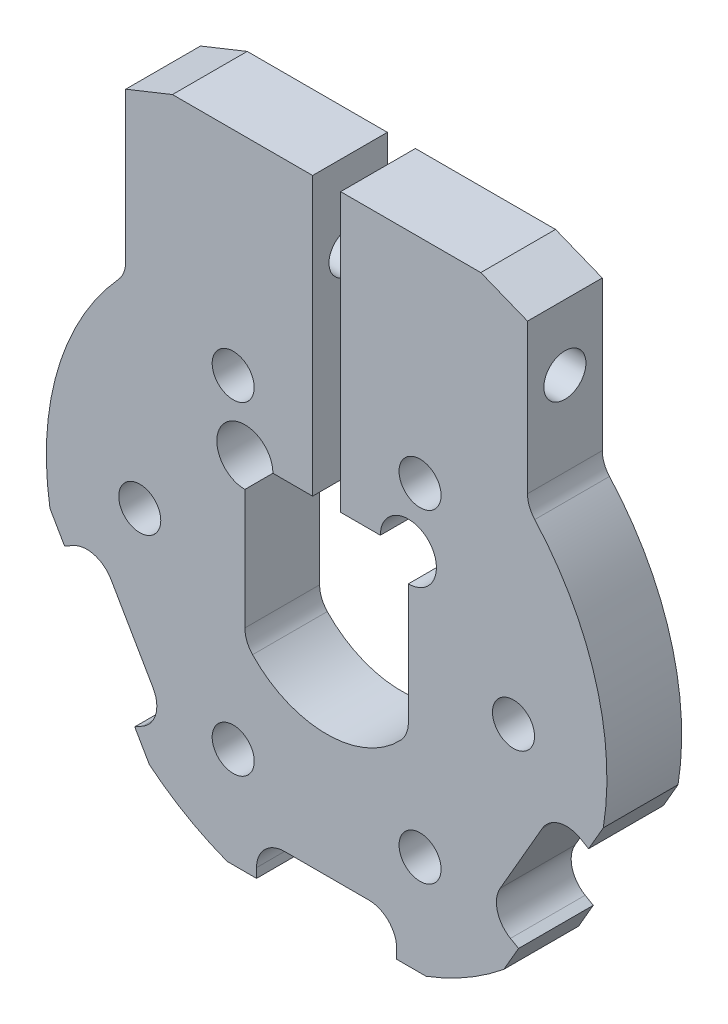
from build123d import *

# Parameters (mm, degrees)
AUFSATZ_LINEAR_AUSTRAGEN1_DEPTH = 8
DURCHGANGSLOCH_F_R_M41_D        = 4.5
DURCHGANGSLOCH_F_R_M42_D        = 4.5


with BuildPart() as part:
    # Skizze1 → Aufsatz-Linear austragen1 (new body)
    with BuildSketch(Plane.XY):
        with BuildLine():
            Line((4.5, -24.047375097), (-4.5, -24.047375097))
            ThreePointArc((-4.5, -24.047375097), (-6.621320344, -24.926054753), (-7.5, -27.047375097))
            Line((-7.5, -27.047375097), (-7.5, -28.047375097))
            Line((-7.5, -28.047375097), (-10.646349149, -28.047375097))
            ThreePointArc((-10.646349149, -28.047375097), (-15, -25.980762114), (-18.966564769, -23.243696368))
            Line((-18.966564769, -23.243696368), (-20.539739343, -20.518878077))
            Line((-20.539739343, -20.518878077), (-19.673713939, -20.018878077))
            ThreePointArc((-19.673713939, -20.018878077), (-18.27593646, -18.197259001), (-18.575637728, -15.920801865))
            Line((-18.575637728, -15.920801865), (-23.075637728, -8.126573231))
            ThreePointArc((-23.075637728, -8.126573231), (-24.897256804, -6.728795752), (-27.173713939, -7.02849702))
            Line((-27.173713939, -7.02849702), (-28.039739343, -7.52849702))
            Line((-28.039739343, -7.52849702), (-29.612913917, -4.803678728))
            ThreePointArc((-29.612913917, -4.803678728), (-28.775894551, 8.482210373), (-22.272727273, 20.097900881))
            ThreePointArc((-22.272727273, 20.097900881), (-21.699837667, 21.031080126), (-21.5, 22.107690969))
            Line((-21.5, 22.107690969), (-21.5, 38.107690969))
            Line((-21.5, 38.107690969), (-16.5, 40.107690969))
            Line((-16.5, 40.107690969), (-1.5, 40.107690969))
            Line((-1.5, 40.107690969), (-1.5, 10.383139126))
            Line((-1.5, 10.383139126), (-5.75, 10.383139126))
            ThreePointArc((-5.75, 10.383139126), (-10.871320344, 12.50445947), (-8.75, 7.383139126))
            Line((-8.75, 7.383139126), (-8.75, -5.459334644))
            ThreePointArc((-8.75, -5.459334644), (-8.536286844, -6.571362352), (-7.925596252, -7.524953425))
            ThreePointArc((-7.925596252, -7.524953425), (0, -10.928860874), (7.925596252, -7.524953425))
            ThreePointArc((7.925596252, -7.524953425), (8.536286844, -6.571362352), (8.75, -5.459334644))
            Line((8.75, -5.459334644), (8.75, 7.383139126))
            ThreePointArc((8.75, 7.383139126), (10.871320344, 12.50445947), (5.75, 10.383139126))
            Line((5.75, 10.383139126), (1.5, 10.383139126))
            Line((1.5, 10.383139126), (1.5, 40.107690969))
            Line((1.5, 40.107690969), (16.5, 40.107690969))
            Line((16.5, 40.107690969), (21.5, 38.107690969))
            Line((21.5, 38.107690969), (21.5, 22.107690969))
            ThreePointArc((21.5, 22.107690969), (21.699837667, 21.031080126), (22.272727273, 20.097900881))
            ThreePointArc((22.272727273, 20.097900881), (28.775894551, 8.482210373), (29.612913917, -4.803678728))
            Line((29.612913917, -4.803678728), (28.039739343, -7.52849702))
            Line((28.039739343, -7.52849702), (27.173713939, -7.02849702))
            ThreePointArc((27.173713939, -7.02849702), (24.897256804, -6.728795752), (23.075637728, -8.126573231))
            Line((23.075637728, -8.126573231), (18.575637728, -15.920801865))
            ThreePointArc((18.575637728, -15.920801865), (18.27593646, -18.197259001), (19.673713939, -20.018878077))
            Line((19.673713939, -20.018878077), (20.539739343, -20.518878077))
            Line((20.539739343, -20.518878077), (18.966564769, -23.243696368))
            ThreePointArc((18.966564769, -23.243696368), (15, -25.980762114), (10.646349149, -28.047375097))
            Line((10.646349149, -28.047375097), (7.5, -28.047375097))
            Line((7.5, -28.047375097), (7.5, -27.047375097))
            ThreePointArc((7.5, -27.047375097), (6.621320344, -24.926054753), (4.5, -24.047375097))
        make_face()
    extrude(amount=AUFSATZ_LINEAR_AUSTRAGEN1_DEPTH)

    # Durchgangsloch für M41 (through all)
    with Locations(Plane(origin=(21.5, 0, 0), x_dir=(0, 0, -1), z_dir=(1, 0, 0))):
        with Locations((-4, 31.107690969)):
            Hole(DURCHGANGSLOCH_F_R_M41_D / 2)

    # Durchgangsloch für M42 (through all)
    with Locations(Plane.XY.offset(8)):
        with Locations((-20, 0), (-10, 17.320508076), (10, 17.320508076), (20, 0), (10, -17.320508076), (-10, -17.320508076)):
            Hole(DURCHGANGSLOCH_F_R_M42_D / 2)


solid = part.part
